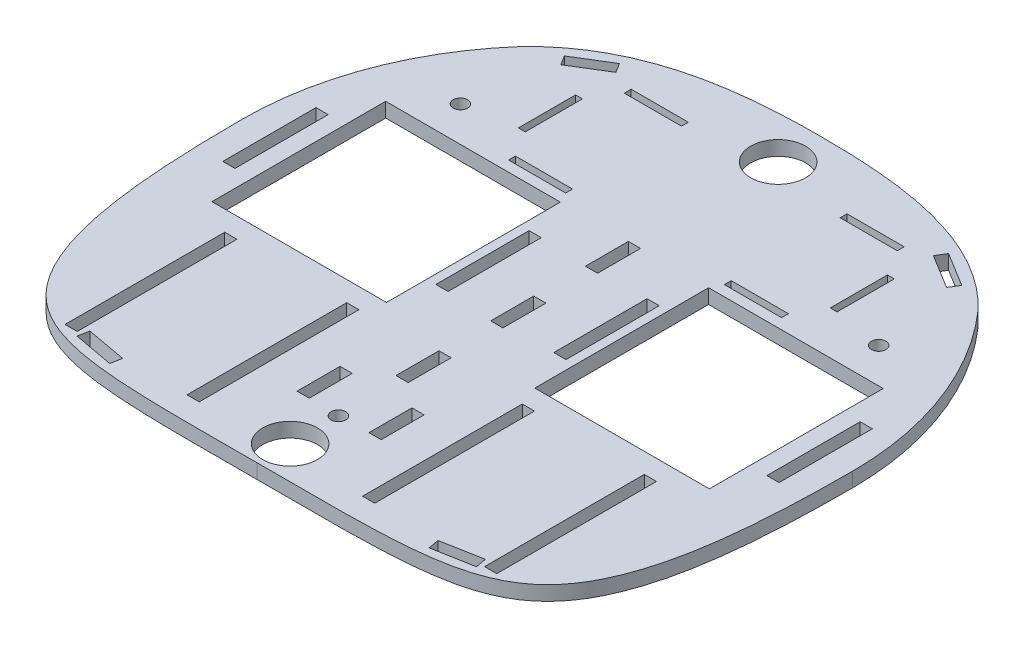
from build123d import *

# Parameters (mm, degrees)
BASE_DEPTH            = 6.35
SKETCH6_W             = 76.3515
SKETCH6_H             = 76
SKETCH6_W_2           = 5.334
SKETCH6_H_2           = 40.767
WHEELSHAFTCUT_DEPTH   = 189.692256213
SKETCH8_W             = 5.334
SKETCH8_H             = 69.827
SKETCH8_H_2           = 18.796
MOTORCUT_DEPTH        = 189.692256213
SKETCH10_W            = 25
SKETCH10_H            = 3
SKETCH10_W_2          = 3
SKETCH10_H_2          = 25
VELCROCUT_DEPTH       = 189.692256213
SKETCH11_R            = 3.175
SCREWCUT_DEPTH        = 189.692256213
SKETCH13_W            = 5.334
SKETCH13_H            = 18.796
SUPPORTSTRUTCUT_DEPTH = 189.692256213
EMPTYSPACETRIM_DEPTH  = 189.692256213
TAPESENSORCUT_DEPTH   = 185.275595127
SKETCH17_R            = 12
CASTERCUT_DEPTH       = 185.275595127


with BuildPart() as part:
    # Sketch1 → Base (new body)
    with BuildSketch(Plane(origin=(0, 0, 0), x_dir=(1, 0, 0), z_dir=(0, 1, 0))):
        with BuildLine():
            ThreePointArc((133.35, 0), (0, 133.35), (-133.35, 0))
            add(Edge.make_bspline(
                [(-133.35, 0), (-133.35, -51.197979728), (-123.803376308, -129.805052089), (-58.427993604, -127), (0, -127)],
                knots=[0, 0, 0, 0, 0.502616309, 1, 1, 1, 1], degree=3))
            add(Edge.make_bspline(
                [(133.35, 0), (133.35, -51.197979728), (123.803376308, -129.805052089), (58.427993604, -127), (0, -127)],
                knots=[0, 0, 0, 0, 0.502616309, 1, 1, 1, 1], degree=3))
        make_face()
    extrude(amount=BASE_DEPTH)

    # Sketch6 → WheelShaftCut (cut, through all)
    with BuildSketch(Plane(origin=(0, 6.35, 0), x_dir=(1, 0, 0), z_dir=(0, 1, 0))):
        with Locations((-70.592348141, 0)):
            Rectangle(SKETCH6_W, SKETCH6_H)
        with Locations((-118.959848141, 0)):
            Rectangle(SKETCH6_W_2, SKETCH6_H_2)
        with Locations((-25.780848141, 0)):
            Rectangle(SKETCH6_W_2, SKETCH6_H_2)
        with Locations((25.780848141, 0)):
            Rectangle(SKETCH6_W_2, SKETCH6_H_2)
        with Locations((118.959848141, 0)):
            Rectangle(SKETCH6_W_2, SKETCH6_H_2)
        with Locations((70.592348141, 0)):
            Rectangle(SKETCH6_W, SKETCH6_H)
    extrude(amount=-WHEELSHAFTCUT_DEPTH, mode=Mode.SUBTRACT)

    # Sketch8 → MotorCut (cut, through all)
    with BuildSketch(Plane(origin=(0, 6.35, 0), x_dir=(1, 0, 0), z_dir=(0, 1, 0))):
        with Locations((-38.378348141, -81.6765)):
            Rectangle(SKETCH8_W, SKETCH8_H)
        with Locations((-91.718348141, -81.6765)):
            Rectangle(SKETCH8_W, SKETCH8_H)
        with Locations((15.718348141, -81.74)):
            Rectangle(SKETCH8_W, SKETCH8_H_2)
        with Locations((91.718348141, -81.6765)):
            Rectangle(SKETCH8_W, SKETCH8_H)
        with Locations((38.378348141, -81.6765)):
            Rectangle(SKETCH8_W, SKETCH8_H)
        with Locations((-15.718348141, -81.74)):
            Rectangle(SKETCH8_W, SKETCH8_H_2)
    extrude(amount=-MOTORCUT_DEPTH, mode=Mode.SUBTRACT)

    # Sketch10 → VelcroCut (cut, through all)
    with BuildSketch(Plane(origin=(0, 6.35, 0), x_dir=(1, 0, 0), z_dir=(0, 1, 0))):
        with Locations((-47.19, 44.12)):
            Rectangle(SKETCH10_W, SKETCH10_H)
        with Locations((-47.19, 94.745)):
            Rectangle(SKETCH10_W, SKETCH10_H)
        with Locations((-68.175, 69.4325)):
            Rectangle(SKETCH10_W_2, SKETCH10_H_2)
        with Locations((68.175, 69.4325)):
            Rectangle(SKETCH10_W_2, SKETCH10_H_2)
        with Locations((47.19, 94.745)):
            Rectangle(SKETCH10_W, SKETCH10_H)
        with Locations((47.19, 44.12)):
            Rectangle(SKETCH10_W, SKETCH10_H)
    extrude(amount=-VELCROCUT_DEPTH, mode=Mode.SUBTRACT)

    # Sketch11 → ScrewCut (cut, through all)
    with BuildSketch(Plane(origin=(0, 6.35, 0), x_dir=(1, 0, 0), z_dir=(0, 1, 0))):
        with Locations((0, -91.44)):
            Circle(SKETCH11_R)
        with Locations((-91.44, 53.34)):
            Circle(SKETCH11_R)
        with Locations((91.44, 53.34)):
            Circle(SKETCH11_R)
    extrude(amount=-SCREWCUT_DEPTH, mode=Mode.SUBTRACT)

    # Sketch13 → SupportStrutCut (cut, through all)
    with BuildSketch(Plane(origin=(0, 6.35, 0), x_dir=(1, 0, 0), z_dir=(0, 1, 0))):
        with Locations((0, 28.602)):
            Rectangle(SKETCH13_W, SKETCH13_H)
        with Locations((0, -12.8)):
            Rectangle(SKETCH13_W, SKETCH13_H)
        with Locations((0, -54.202)):
            Rectangle(SKETCH13_W, SKETCH13_H)
    extrude(amount=-SUPPORTSTRUTCUT_DEPTH, mode=Mode.SUBTRACT)

    # Sketch16 → EmptySpaceTrim (cut, through all)
    with BuildSketch(Plane(origin=(0, 6.35, 0), x_dir=(1, 0, 0), z_dir=(0, 1, 0))):
        with BuildLine():
            Line((-100.033122546, 133.35), (-100.033122546, 88.179345052))
            add(Edge.make_bspline(
                [(-100.033122546, 88.179345052), (-73.919529929, 115.91021885), (-34.972901221, 119.822808394), (0, 119.822808394)],
                knots=[0, 0, 0, 0, 1, 1, 1, 1], degree=3))
            add(Edge.make_bspline(
                [(100.033122546, 88.179345052), (73.919529929, 115.91021885), (34.972901221, 119.822808394), (0, 119.822808394)],
                knots=[0, 0, 0, 0, 1, 1, 1, 1], degree=3))
            Line((100.033122546, 88.179345052), (100.033122546, 133.35))
            Line((100.033122546, 133.35), (-100.033122546, 133.35))
        make_face()
    extrude(amount=-EMPTYSPACETRIM_DEPTH, mode=Mode.SUBTRACT)

    # Sketch15 → TapeSensorCut (cut, through all)
    with BuildSketch(Plane(origin=(0, 6.35, 0), x_dir=(1, 0, 0), z_dir=(0, 1, 0))):
        Polygon((-87.346843545, -118.396296281), (-69.820843545, -121.616839259), (-68.948631108, -116.870311953), (-86.474631108, -113.649768975), align=None)
        Polygon((-84.353230389, 90.117551381), (-69.417317646, 99.287021733), (-71.942244264, 103.3998093), (-86.878157007, 94.230338948), align=None)
        Polygon((86.878157007, 94.230338948), (71.942244264, 103.3998093), (69.417317646, 99.287021733), (84.353230389, 90.117551381), align=None)
        Polygon((86.474631108, -113.649768975), (68.948631108, -116.870311953), (69.820843545, -121.616839259), (87.346843545, -118.396296281), align=None)
    extrude(amount=-TAPESENSORCUT_DEPTH, mode=Mode.SUBTRACT)

    # Sketch17 → CasterCut (cut, through all)
    with BuildSketch(Plane(origin=(0, 6.35, 0), x_dir=(1, 0, 0), z_dir=(0, 1, 0))):
        with Locations((0, 100.834589665)):
            Circle(SKETCH17_R)
        with Locations((0, -112.562458365)):
            Circle(SKETCH17_R)
    extrude(amount=-CASTERCUT_DEPTH, mode=Mode.SUBTRACT)


solid = part.part
